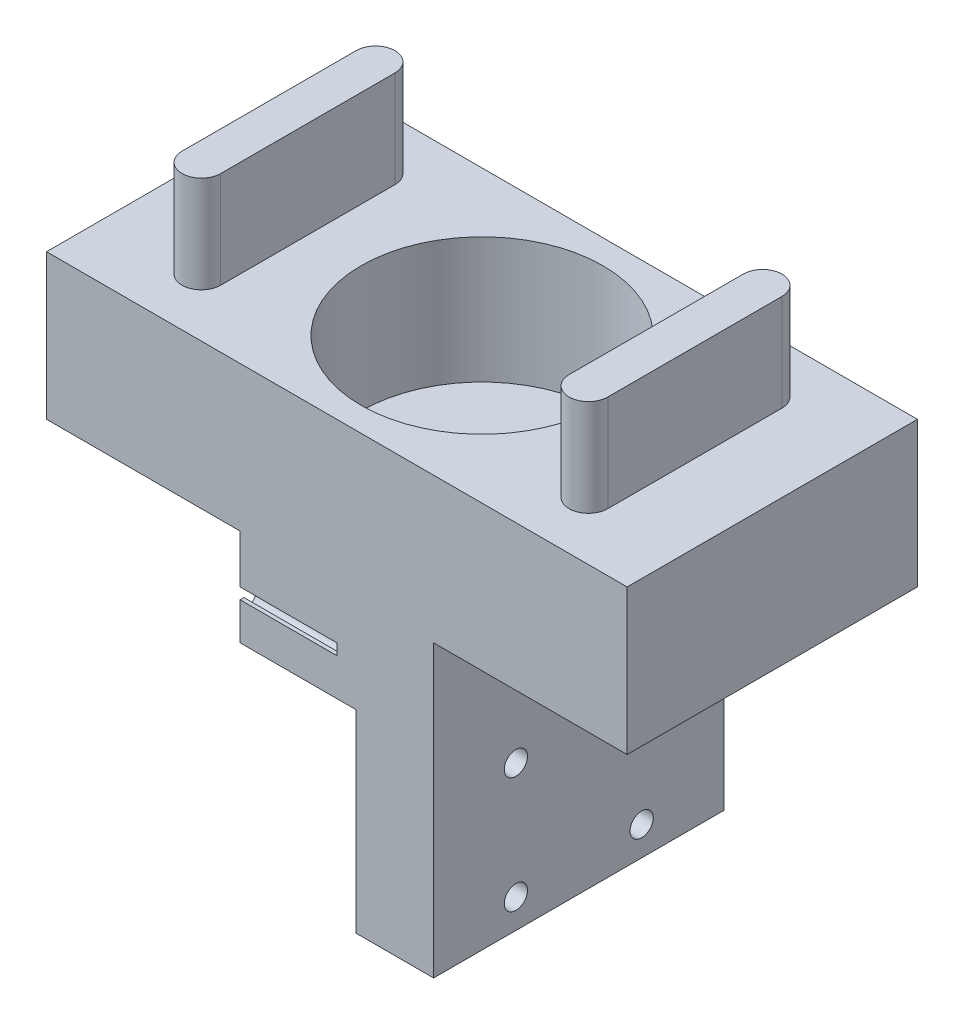
from build123d import *

# Parameters (mm, degrees)
SKETCH_1_W                   = 20
SKETCH_1_H                   = 30
EXTRUDE_1_DEPTH              = 30
CUT_EXTRUDE_1_DEPTH          = 10
SKETCH_5_W                   = 30
SKETCH_5_H                   = 20
CUT_EXTRUDE_2_DEPTH          = 10
HOLE_WIZARD_M2_1_D           = 2.4
HOLE_WIZARD_M2_1_CSINK_D     = 2.45
HOLE_WIZARD_M2_1_CSINK_ANGLE = 90
SKETCH_10_W                  = 60
SKETCH_10_H                  = 30
EXTRUDE_2_DEPTH              = 15
SKETCH_11_R                  = 12.5
CUT_EXTRUDE_4_DEPTH          = 13
EXTRUDE_4_DEPTH              = 10
SKETCH_13_W                  = 30
SKETCH_13_H                  = 20
SKETCH_13_R                  = 2.5
CUT_EXTRUDE_5_DEPTH          = 2


with BuildPart() as part:
    # 草图1 → 凸台-拉伸1 (new body)
    with BuildSketch(Plane.XY):
        with Locations((10, 15)):
            Rectangle(SKETCH_1_W, SKETCH_1_H)
    extrude(amount=EXTRUDE_1_DEPTH)

    # 草图3 → 切除-拉伸1 (cut)
    with BuildSketch(Plane.ZY):
        with BuildLine():
            Line((11.6, 23.6), (11.6, 23.85))
            Line((11.6, 23.85), (12.4, 23.85))
            Line((12.4, 23.85), (12.4, 23.6))
            ThreePointArc((12.4, 23.6), (13, 23), (13.6, 23.6))
            Line((13.6, 23.6), (13.6, 23.85))
            Line((13.6, 23.85), (14.4, 23.85))
            Line((14.4, 23.85), (14.4, 23.6))
            ThreePointArc((14.4, 23.6), (15, 23), (15.6, 23.6))
            Line((15.6, 23.6), (15.6, 23.85))
            Line((15.6, 23.85), (16.4, 23.85))
            Line((16.4, 23.85), (16.4, 23.6))
            ThreePointArc((16.4, 23.6), (17, 23), (17.6, 23.6))
            Line((17.6, 23.6), (17.6, 23.85))
            Line((17.6, 23.85), (18.4, 23.85))
            Line((18.4, 23.85), (18.4, 23.6))
            ThreePointArc((18.4, 23.6), (19, 23), (19.6, 23.6))
            Line((19.6, 23.6), (19.6, 23.85))
            Line((19.6, 23.85), (20.4, 23.85))
            Line((20.4, 23.85), (20.4, 23.6))
            ThreePointArc((20.4, 23.6), (21, 23), (21.6, 23.6))
            Line((21.6, 23.6), (21.6, 23.85))
            Line((21.6, 23.85), (22.4, 23.85))
            Line((22.4, 23.85), (22.4, 23.6))
            ThreePointArc((22.4, 23.6), (23, 23), (23.6, 23.6))
            Line((23.6, 23.6), (23.6, 23.85))
            Line((23.6, 23.85), (24.4, 23.85))
            Line((24.4, 23.85), (24.4, 23.6))
            ThreePointArc((24.4, 23.6), (25, 23), (25.6, 23.6))
            Line((25.6, 23.6), (25.6, 23.85))
            Line((25.6, 23.85), (26.4, 23.85))
            Line((26.4, 23.85), (26.4, 23.6))
            ThreePointArc((26.4, 23.6), (27, 23), (27.6, 23.6))
            Line((27.6, 23.6), (27.6, 23.85))
            Line((27.6, 23.85), (28.4, 23.85))
            Line((28.4, 23.85), (28.4, 23.6))
            ThreePointArc((28.4, 23.6), (29, 23), (29.6, 23.6))
            Line((29.6, 23.6), (29.6, 23.85))
            Line((29.6, 23.85), (30.4, 23.85))
            Line((30.4, 23.85), (30.4, 23.6))
            ThreePointArc((30.4, 23.6), (30.575735931, 23.175735931), (31, 23))
            Line((31, 23), (31, 25))
            Line((31, 25), (15, 25))
            Line((15, 25), (-1, 25))
            Line((-1, 25), (-1, 23))
            ThreePointArc((-1, 23), (-0.575735931, 23.175735931), (-0.4, 23.6))
            Line((-0.4, 23.6), (-0.4, 23.85))
            Line((-0.4, 23.85), (0.4, 23.85))
            Line((0.4, 23.85), (0.4, 23.6))
            ThreePointArc((0.4, 23.6), (1, 23), (1.6, 23.6))
            Line((1.6, 23.6), (1.6, 23.85))
            Line((1.6, 23.85), (2.4, 23.85))
            Line((2.4, 23.85), (2.4, 23.6))
            ThreePointArc((2.4, 23.6), (3, 23), (3.6, 23.6))
            Line((3.6, 23.6), (3.6, 23.85))
            Line((3.6, 23.85), (4.4, 23.85))
            Line((4.4, 23.85), (4.4, 23.6))
            ThreePointArc((4.4, 23.6), (5, 23), (5.6, 23.6))
            Line((5.6, 23.6), (5.6, 23.85))
            Line((5.6, 23.85), (6.4, 23.85))
            Line((6.4, 23.85), (6.4, 23.6))
            ThreePointArc((6.4, 23.6), (7, 23), (7.6, 23.6))
            Line((7.6, 23.6), (7.6, 23.85))
            Line((7.6, 23.85), (8.4, 23.85))
            Line((8.4, 23.85), (8.4, 23.6))
            ThreePointArc((8.4, 23.6), (9, 23), (9.6, 23.6))
            Line((9.6, 23.6), (9.6, 23.85))
            Line((9.6, 23.85), (10.4, 23.85))
            Line((10.4, 23.85), (10.4, 23.6))
            ThreePointArc((10.4, 23.6), (11, 23), (11.6, 23.6))
        make_face()
    extrude(amount=-CUT_EXTRUDE_1_DEPTH, mode=Mode.SUBTRACT)

    # 草图5 → 切除-拉伸2 (cut)
    with BuildSketch(Plane.ZY):
        with Locations((15, 10)):
            Rectangle(SKETCH_5_W, SKETCH_5_H)
    extrude(amount=-CUT_EXTRUDE_2_DEPTH, mode=Mode.SUBTRACT)

    # M2 间隙孔1 (through all)
    with Locations(Plane.ZY):
        with Locations((21.5, 15), (8.5, 3), (8.5, 15), (21.5, 3)):
            CounterSinkHole(HOLE_WIZARD_M2_1_D / 2, HOLE_WIZARD_M2_1_CSINK_D / 2, counter_sink_angle=HOLE_WIZARD_M2_1_CSINK_ANGLE)

    # 草图10 → 凸台-拉伸2 (add)
    with BuildSketch(Plane(origin=(0, 30, 0), x_dir=(1, 0, 0), z_dir=(0, 1, 0))):
        with Locations((10, -15)):
            Rectangle(SKETCH_10_W, SKETCH_10_H)
    extrude(amount=EXTRUDE_2_DEPTH)

    # 草图11 → 切除-拉伸4 (cut)
    with BuildSketch(Plane(origin=(0, 45, 0), x_dir=(1, 0, 0), z_dir=(0, 1, 0))):
        with Locations((10, -15)):
            Circle(SKETCH_11_R)
    extrude(amount=-CUT_EXTRUDE_4_DEPTH, mode=Mode.SUBTRACT)

    # 草图12 → 凸台-拉伸4 (add)
    with BuildSketch(Plane(origin=(0, 45, 0), x_dir=(1, 0, 0), z_dir=(0, 1, 0))):
        with BuildLine():
            Line((-12, -6), (-12, -24))
            ThreePointArc((-12, -24), (-10, -26), (-8, -24))
            Line((-8, -24), (-8, -6))
            ThreePointArc((-8, -6), (-10, -4), (-12, -6))
        make_face()
        with BuildLine():
            Line((28, -6), (28, -24))
            ThreePointArc((28, -24), (30, -26), (32, -24))
            Line((32, -24), (32, -6))
            ThreePointArc((32, -6), (30, -4), (28, -6))
        make_face()
    extrude(amount=EXTRUDE_4_DEPTH)

    # 草图13 → 切除-拉伸5 (cut)
    with BuildSketch(Plane.ZY.offset(-10)):
        with Locations((15, 10)):
            Rectangle(SKETCH_13_W, SKETCH_13_H)
        with Locations((8.5, 3)):
            Circle(SKETCH_13_R, mode=Mode.SUBTRACT)
        with Locations((21.5, 3)):
            Circle(SKETCH_13_R, mode=Mode.SUBTRACT)
        with Locations((8.5, 15)):
            Circle(SKETCH_13_R, mode=Mode.SUBTRACT)
        with Locations((21.5, 15)):
            Circle(SKETCH_13_R, mode=Mode.SUBTRACT)
    extrude(amount=-CUT_EXTRUDE_5_DEPTH, mode=Mode.SUBTRACT)


solid = part.part
